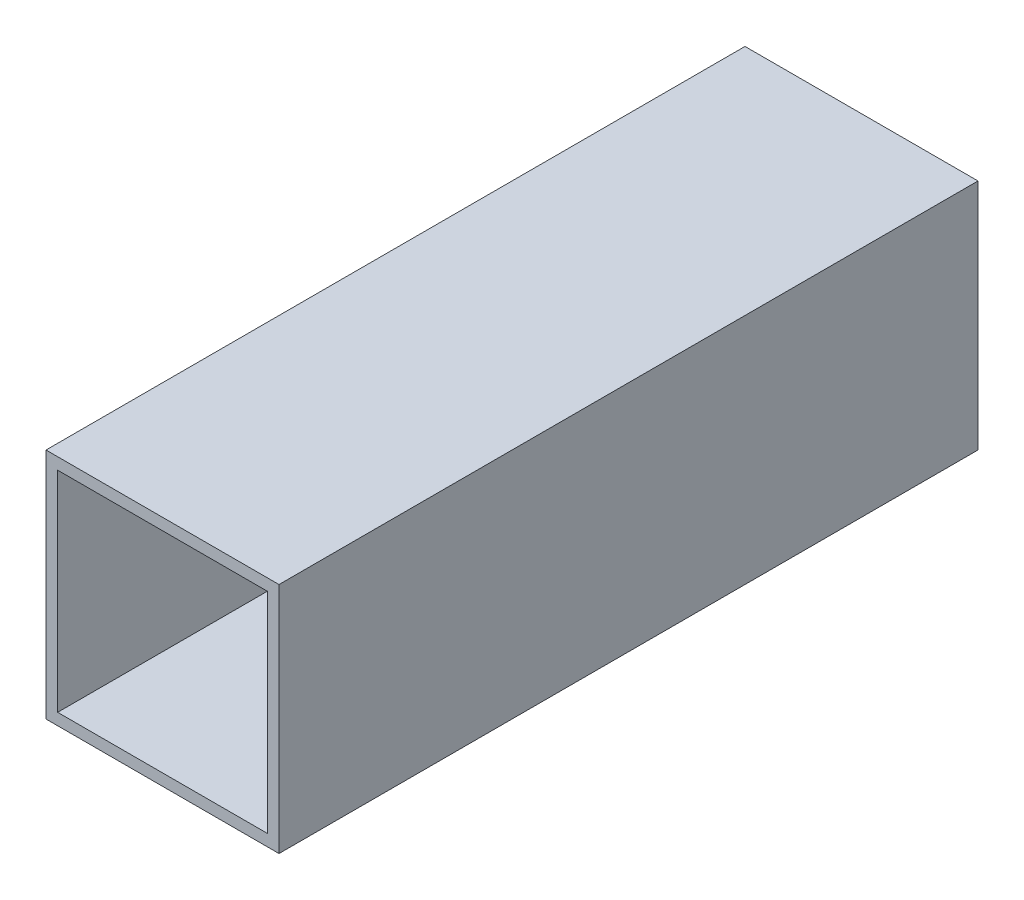
from build123d import *

# Parameters (mm, degrees)
SKETCH1_W           = 50.8
SKETCH1_H           = 50.8
SKETCH1_W_2         = 45.72
SKETCH1_H_2         = 45.72
BOSS_EXTRUDE1_DEPTH = 152.4


with BuildPart() as part:
    # Sketch1 → Boss-Extrude1 (new body)
    with BuildSketch(Plane.XY):
        with Locations((27.032857143, 25.4)):
            Rectangle(SKETCH1_W, SKETCH1_H)
        with Locations((27.032857143, 25.4)):
            Rectangle(SKETCH1_W_2, SKETCH1_H_2, mode=Mode.SUBTRACT)
    extrude(amount=BOSS_EXTRUDE1_DEPTH)


solid = part.part
